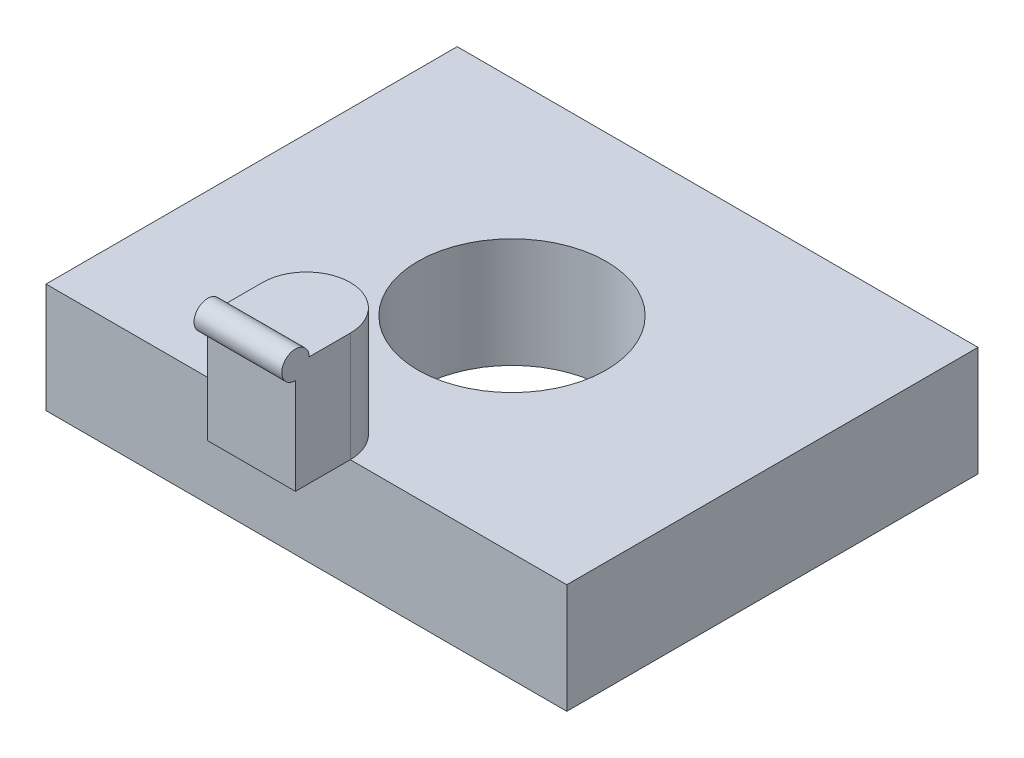
from build123d import *

# Parameters (mm, degrees)
SKETCH1_W           = 95
SKETCH1_H           = 75
BOSS_EXTRUDE1_DEPTH = 10
SKETCH2_W           = 8
SKETCH2_H           = 20
REVOLVE1_ANGLE      = 180
SKETCH3_W           = 16
SKETCH3_H           = 20
BOSS_EXTRUDE2_DEPTH = 10
SKETCH4_R           = 17.178882312
CUT_EXTRUDE1_DEPTH  = 71.089228844
SWEEP2_START        = -8
SWEEP2_DEPTH        = 16


# Read off the part's stored shape, not the designer's step: Sweep2
with BuildPart() as part:
    # Sketch1 → Boss-Extrude1 (new, symmetric)
    with BuildSketch(Plane(origin=(0, 0, 0), x_dir=(1, 0, 0), z_dir=(0, 1, 0))):
        Rectangle(SKETCH1_W, SKETCH1_H)
    extrude(amount=BOSS_EXTRUDE1_DEPTH, both=True)

    # Sketch2 → Revolve1 (revolve)
    with BuildSketch(Plane.XY.offset(37.5)):
        with Locations((-4, 20)):
            Rectangle(SKETCH2_W, SKETCH2_H)
    revolve(axis=Axis((0, 10, 37.5), (0, -1, 0)), revolution_arc=REVOLVE1_ANGLE)

    # Sketch3 → Boss-Extrude2 (add)
    with BuildSketch(Plane.XY.offset(37.5)):
        with Locations((0, 20)):
            Rectangle(SKETCH3_W, SKETCH3_H)
    extrude(amount=BOSS_EXTRUDE2_DEPTH)

    # Sketch4 → Cut-Extrude1 (cut, through all)
    with BuildSketch(Plane(origin=(0, 10, 0), x_dir=(1, 0, 0), z_dir=(0, 1, 0))):
        with Locations(Location((0, 0, 0), (0, 0, 270))):
            Circle(SKETCH4_R)
    extrude(amount=-CUT_EXTRUDE1_DEPTH, mode=Mode.SUBTRACT)

    # Sweep2 outline → Sweep2 (add)
    with BuildSketch(Plane.YZ.offset(SWEEP2_START)):
        with BuildLine():
            ThreePointArc((30, 45), (31.767766953, 49.267766953), (27.5, 47.5))
            Line((27.5, 47.5), (30, 47.5))
            Line((30, 47.5), (30, 45))
        make_face()
    extrude(amount=SWEEP2_DEPTH)


solid = part.part
